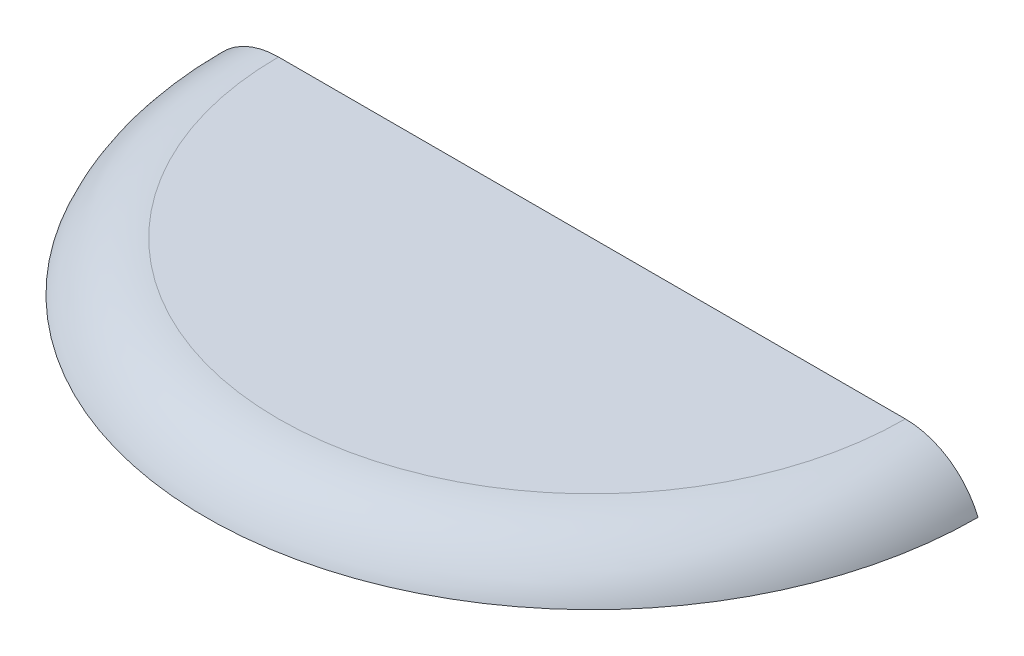
from build123d import *

# Parameters (mm, degrees)
CUT_EXTRUDE3_DEPTH           = 60
CUT_EXTRUDE5_DEPTH           = 2
CUT_EXTRUDE5_DEPTH_BACK      = 30
SKETCH9_R                    = 38
SKETCH9_R_2                  = 23
SKETCH19_W                   = 12
SKETCH19_H                   = 36.5
CUT_REVOLVE2_ANGLE           = 65
CUT_REVOLVE2_OTHER_WAY_ANGLE = 65
SKETCH21_W                   = 3.25
SKETCH21_H                   = 4
BOSS_EXTRUDE3_DEPTH          = 1.35
CIRPATTERN1_COUNT            = 5
CUT_EXTRUDE9_START           = -5
CUT_EXTRUDE9_DEPTH           = 5
SKETCH23_R                   = 10.5
CUT_EXTRUDE10_DEPTH          = 10
SKETCH24_W                   = 17
SKETCH24_H                   = 12
BOSS_EXTRUDE4_DEPTH          = 8
SKETCH26_W                   = 12
SKETCH26_H                   = 8
CUT_EXTRUDE11_DEPTH          = 10
SKETCH27_W                   = 4
SKETCH27_H                   = 5
CUT_EXTRUDE12_DEPTH          = 5
CUT_EXTRUDE14_DEPTH          = 2
CUT_EXTRUDE14_DEPTH_BACK     = 30
SKETCH29_R                   = 1
CUT_EXTRUDE15_DEPTH          = 15
FILLET1_R                    = 6
FILLET2_R                    = 8
INTERSECT2_DEPTH             = 58.427876097


# Read off the part's stored shape, not the designer's step: Cut-Extrude9, Intersect2
with BuildPart() as part:
    # Sketch1 → Revolve1 (revolve)
    with BuildSketch(Plane.XY, mode=Mode.PRIVATE) as revolve1_sk:
        with BuildLine():
            Line((0, 63.427876097), (32, 63.427876097))
            ThreePointArc((32, 63.427876097), (37.656854249, 61.084730346), (40, 55.427876097))
            Line((40, 55.427876097), (40, 28.846818009))
            ThreePointArc((40, 28.846818009), (38.792081772, 24.082439968), (35.460140376, 20.469057744))
            Line((35.460140376, 20.469057744), (28.539859624, 15.958818353))
            ThreePointArc((28.539859624, 15.958818353), (25.207918228, 12.345436129), (24, 7.581058088))
            Line((24, 7.581058088), (24, 3.25))
            Line((24, 3.25), (24.35, 3))
            Line((24.35, 3), (24.35, 0))
            Line((24.35, 0), (22.5, 0))
            Line((22.5, 0), (22.5, 12.5))
            ThreePointArc((22.5, 12.5), (22.353553391, 12.853553391), (22, 13))
            Line((22, 13), (0, 13))
            Line((0, 13), (0, 63.427876097))
        make_face()
    revolve(revolve1_sk.sketch.rotate(Axis((0, 0, 0), (0, 1, 0)), 90), axis=Axis((0, 0, 0), (0, 1, 0)))

    # Sketch11 → Cut-Extrude3 (cut)
    with BuildSketch(Plane(origin=(0, 13, 0), x_dir=(-1, 0, 0), z_dir=(0, -1, 0))):
        with BuildLine():
            Line((-21, 0), (21, 0))
            ThreePointArc((21, 0), (0, 21), (-21, 0))
        make_face()
    extrude(amount=-CUT_EXTRUDE3_DEPTH, mode=Mode.SUBTRACT)

    # Sketch9 → Cut-Extrude5 (cut, two sides: drawn at the far end of the back side and taken through both)
    with BuildSketch(Plane(origin=(0, 55.427876097, 0), x_dir=(1, 0, 0), z_dir=(0, 1, 0)).offset(-CUT_EXTRUDE5_DEPTH_BACK)):
        with Locations(Location((0, 0, 0), (0, 0, 270))):
            Circle(SKETCH9_R)
        with Locations(Location((0, 0, 0), (0, 0, 270))):
            Circle(SKETCH9_R_2, mode=Mode.SUBTRACT)
    extrude(amount=CUT_EXTRUDE5_DEPTH + CUT_EXTRUDE5_DEPTH_BACK, mode=Mode.SUBTRACT)

    # Sketch19 → Cut-Revolve2 (revolve, cut)
    with BuildSketch(Plane(origin=(0, 0, 0), x_dir=(0, 0, -1), z_dir=(1, 0, 0))):
        with Locations((-41.064715832, 37.177876097)):
            Rectangle(SKETCH19_W, SKETCH19_H)
    revolve(axis=Axis((0, 0, 0), (0, 1, 0)), revolution_arc=CUT_REVOLVE2_ANGLE, mode=Mode.SUBTRACT)

    # Sketch19 → Cut-Revolve2 other way (revolve, cut)
    with BuildSketch(Plane(origin=(0, 0, 0), x_dir=(0, 0, -1), z_dir=(1, 0, 0))):
        with Locations((-41.064715832, 37.177876097)):
            Rectangle(SKETCH19_W, SKETCH19_H)
    revolve(axis=Axis((0, 0, 0), (0, -1, 0)), revolution_arc=CUT_REVOLVE2_OTHER_WAY_ANGLE, mode=Mode.SUBTRACT)

    # Sketch21 → Boss-Extrude3 (add)
    with BuildSketch(Plane(origin=(0, 0, 22.5), x_dir=(-1, 0, 0), z_dir=(0, 0, -1))):
        with Locations((0, 2)):
            Rectangle(SKETCH21_W, SKETCH21_H)
    boss_extrude3 = extrude(amount=BOSS_EXTRUDE3_DEPTH)

    # CirPattern1: Boss-Extrude3 ×5 about axis
    cirpattern1_axis = Axis((0, 0, 0), (0, 1, 0))
    for i in range(1, CIRPATTERN1_COUNT):
        add(boss_extrude3.rotate(cirpattern1_axis, i * 360 / CIRPATTERN1_COUNT))

    # Cut-Extrude9 outline → Cut-Extrude9 (cut)
    with BuildSketch(Plane(origin=(0, 63.427876097, 0), x_dir=(1, 0, 0), z_dir=(0, 1, 0)).offset(CUT_EXTRUDE9_START)):
        with BuildLine():
            ThreePointArc((40, 0), (0, 40), (-40, 0))
            Line((-40, 0), (-21, 0))
            ThreePointArc((-21, 0), (0, 21), (21, 0))
            Line((21, 0), (40, 0))
        make_face()
    extrude(amount=CUT_EXTRUDE9_DEPTH, mode=Mode.SUBTRACT)

    # Sketch23 → Cut-Extrude10 (cut)
    with BuildSketch(Plane(origin=(0, 0, -40), x_dir=(-1, 0, 0), z_dir=(0, 0, -1))):
        with Locations((0, 42.137876097)):
            Circle(SKETCH23_R)
    extrude(amount=-CUT_EXTRUDE10_DEPTH, mode=Mode.SUBTRACT)

    # Sketch24 → Boss-Extrude4 (add)
    with BuildSketch(Plane(origin=(0, 58.427876097, 0), x_dir=(1, 0, 0), z_dir=(0, 1, 0))):
        with Locations((0, 30)):
            Rectangle(SKETCH24_W, SKETCH24_H)
    extrude(amount=-BOSS_EXTRUDE4_DEPTH)

    # Sketch26 → Cut-Extrude11 (cut)
    with BuildSketch(Plane(origin=(0, 58.427876097, 0), x_dir=(1, 0, 0), z_dir=(0, 1, 0))):
        with Locations((0, 30)):
            Rectangle(SKETCH26_W, SKETCH26_H)
    extrude(amount=-CUT_EXTRUDE11_DEPTH, mode=Mode.SUBTRACT)

    # Sketch27 → Cut-Extrude12 (cut)
    with BuildSketch(Plane(origin=(8.5, 0, 0), x_dir=(0, 0, -1), z_dir=(1, 0, 0))):
        with Locations((29.5, 53.927876097)):
            Rectangle(SKETCH27_W, SKETCH27_H)
    extrude(amount=-CUT_EXTRUDE12_DEPTH, mode=Mode.SUBTRACT)

    # Sketch28 → Cut-Extrude14 (cut, two sides: drawn at the far end of the back side and taken through both)
    with BuildSketch(Plane(origin=(0, 55.427876097, 0), x_dir=(1, 0, 0), z_dir=(0, 1, 0)).offset(-CUT_EXTRUDE14_DEPTH_BACK)):
        with BuildLine():
            Line((-22.912878475, -2), (22.912878475, -2))
            ThreePointArc((22.912878475, -2), (0, -23), (-22.912878475, -2))
        make_face()
    extrude(amount=CUT_EXTRUDE14_DEPTH + CUT_EXTRUDE14_DEPTH_BACK, mode=Mode.SUBTRACT)

    # Sketch29 → Cut-Extrude15 (cut)
    with BuildSketch(Plane(origin=(0, 0, 0), x_dir=(-1, 0, 0), z_dir=(0, 0, -1))):
        with Locations((-30.416198487, 60.927876097)):
            Circle(SKETCH29_R)
        with Locations((30.416198487, 60.927876097)):
            Circle(SKETCH29_R)
        with Locations((0, 60.927876097)):
            Circle(SKETCH29_R)
    extrude(amount=-CUT_EXTRUDE15_DEPTH, mode=Mode.SUBTRACT)

    # Fillet1
    fillet1_edges = [part.edges().sort_by_distance(p)[0] for p in [
        (21, 35.713938048, 0),
        (-21, 35.713938048, 0),
    ]]
    fillet(fillet1_edges, radius=FILLET1_R)

    # Fillet2
    fillet2_edges = [part.edges().sort_by_distance(p)[0] for p in [
        (-22.912878475, 41.427876097, 2),
        (22.912878475, 41.427876097, 2),
    ]]
    fillet(fillet2_edges, radius=FILLET2_R)

    # Intersect2 outline → Intersect2 (cut)
    with BuildSketch(Plane(origin=(0, 0, 0), x_dir=(1, 0, 0), z_dir=(0, 1, 0))):
        with BuildLine():
            Line((-37.508702776, -13.895942431), (-42, -15.355253362))
            Line((-42, -15.355253362), (-42, -41))
            Line((-42, -41), (42, -41))
            Line((42, -41), (42, -15.355253362))
            Line((42, -15.355253362), (37.508702776, -13.895942431))
            ThreePointArc((37.508702776, -13.895942431), (0, 40), (-37.508702776, -13.895942431))
        make_face()
        with BuildLine():
            ThreePointArc((19.246817919, 8.4), (18.767687244, 2.713664655), (13.747727085, 0))
            Line((13.747727085, 0), (-13.747727085, 0))
            ThreePointArc((-13.747727085, 0), (-18.767687244, 2.713664655), (-19.246817919, 8.4))
            ThreePointArc((-19.246817919, 8.4), (0, 21), (19.246817919, 8.4))
        make_face(mode=Mode.SUBTRACT)
    extrude(amount=INTERSECT2_DEPTH, mode=Mode.SUBTRACT)


solid = part.part
